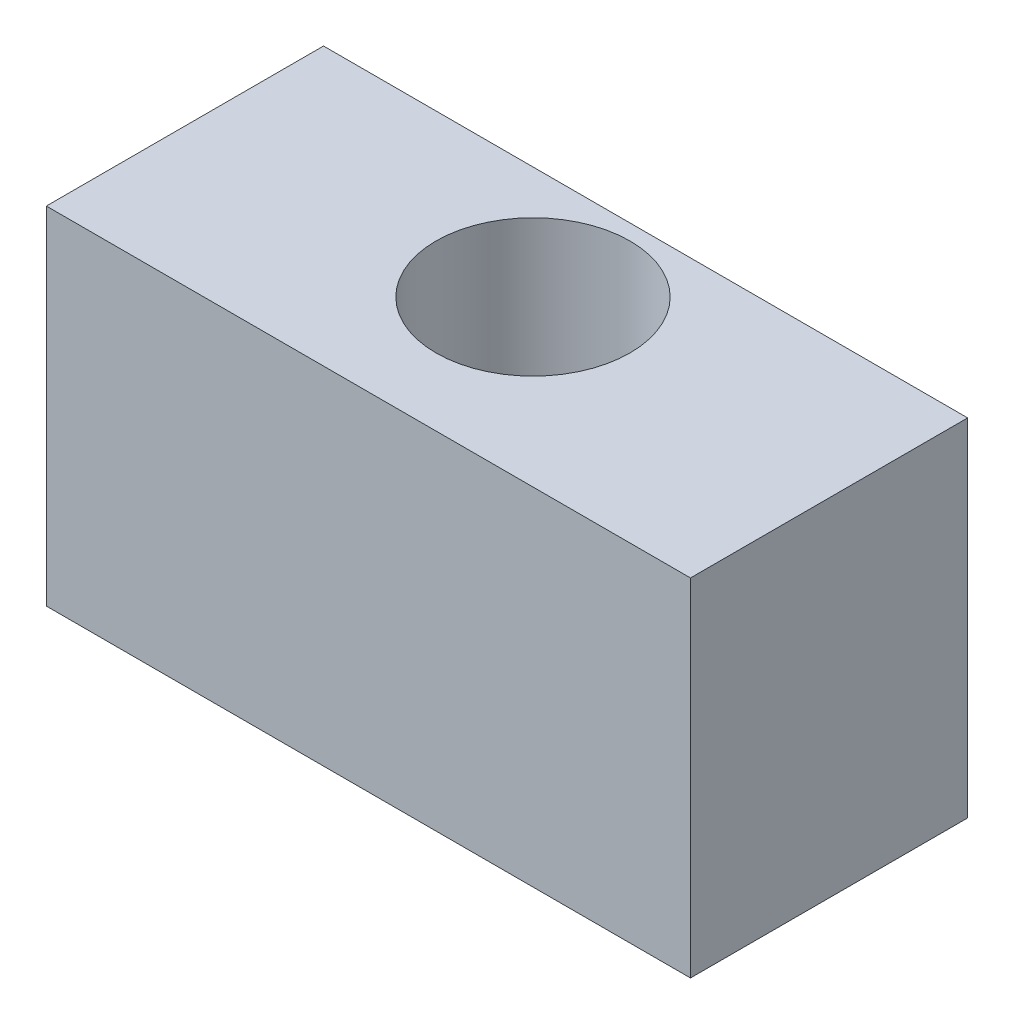
from build123d import *

# Parameters (mm, degrees)
SKETCH1_W           = 29.513896991
SKETCH1_H           = 12.7
SKETCH1_R           = 4.445
BOSS_EXTRUDE1_DEPTH = 15.875


with BuildPart() as part:
    # Sketch1 → Boss-Extrude1 (new body)
    with BuildSketch(Plane(origin=(0, 0, 0), x_dir=(1, 0, 0), z_dir=(0, 1, 0))):
        with Locations((14.756948496, 6.35)):
            Rectangle(SKETCH1_W, SKETCH1_H)
        with Locations((14.756948496, 7.540625)):
            Circle(SKETCH1_R, mode=Mode.SUBTRACT)
    extrude(amount=BOSS_EXTRUDE1_DEPTH)


solid = part.part
